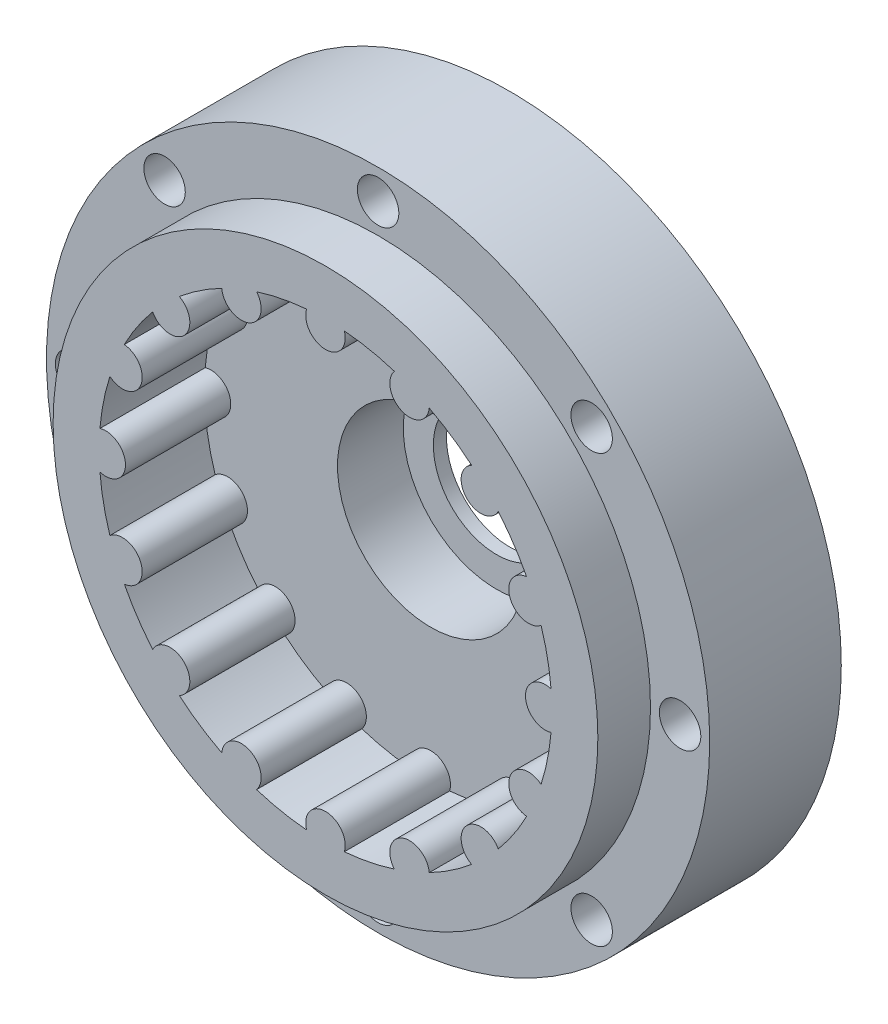
from build123d import *

# Parameters (mm, degrees)
SKETCH1_R           = 32.004
BOSS_EXTRUDE1_DEPTH = 12.7
SKETCH2_OUTSIDE_W   = 84.29
SKETCH2_OUTSIDE_H   = 84.29
SKETCH2_OUTSIDE_R   = 32.004
SKETCH2_OUTSIDE_R_2 = 26.289
CUT_EXTRUDE1_DEPTH  = 2.54
SKETCH4_R           = 13.588999999999995
CUT_EXTRUDE3_DEPTH  = 2.54
SKETCH5_R           = 6.1
CUT_EXTRUDE4_DEPTH  = 46.89745561575282
SKETCH5_3_R         = 9
SKETCH5_3_R_2       = 6.1
CUT_EXTRUDE5_DEPTH  = 6.35
BOSS_EXTRUDE2_START = 7.619999999999999
SKETCH8_R           = 26.289
SKETCH8_R_2         = 21.844
BOSS_EXTRUDE2_DEPTH = 7.619999999999999
SKETCH3_R           = 1.9049999999999996
SKETCH3_R_2         = 1.9050000000000011
SKETCH3_R_3         = 1.9050000000000356
SKETCH3_R_4         = 1.9050000000000542
SKETCH3_R_5         = 1.9050000000000724
SKETCH3_R_6         = 1.9050000000000904
SKETCH3_R_7         = 1.9050000000001055
SKETCH3_R_8         = 1.9050000000001284
SKETCH3_R_9         = 1.9050000000001432
SKETCH3_R_10        = 1.9050000000001643
SKETCH3_R_11        = 1.9050000000001805
SKETCH3_R_12        = 1.9050000000002145
SKETCH3_R_13        = 1.9050000000002163
SKETCH3_R_14        = 1.9050000000002147
SKETCH3_R_15        = 1.9050000000002518
BOSS_EXTRUDE3_DEPTH = 7.619999999999999
SKETCH6_R           = 2.0000000000000004
SKETCH6_R_2         = 2.000000000000001
SKETCH6_R_3         = 1.9999999999999996
SKETCH6_R_4         = 2.0000000000000044
SKETCH6_R_5         = 1.9999999999999971
CUT_EXTRUDE6_DEPTH  = 48.00853148099821
CUT_EXTRUDE7_DEPTH  = 2.54


with BuildPart() as part:
    # Sketch1 → Boss-Extrude1 (new body)
    with BuildSketch(Plane.XY):
        Circle(SKETCH1_R)
    extrude(amount=BOSS_EXTRUDE1_DEPTH)

    # Sketch2 outside → Cut-Extrude1 (cut)
    # profile 1 of 2: a face of its own
    with BuildSketch(Plane.XY.offset(12.7)):
        Rectangle(SKETCH2_OUTSIDE_W, SKETCH2_OUTSIDE_H)
        Circle(SKETCH2_OUTSIDE_R, mode=Mode.SUBTRACT)
    # profile 2 of 2: a face of its own
    with BuildSketch(Plane.XY.offset(12.7)):
        Circle(SKETCH2_OUTSIDE_R_2)
    extrude(amount=-CUT_EXTRUDE1_DEPTH, mode=Mode.SUBTRACT)

    # Sketch4 → Cut-Extrude3 (cut)
    with BuildSketch(Plane.XY.offset(10.159999999999998)):
        Circle(SKETCH4_R)
    extrude(amount=-CUT_EXTRUDE3_DEPTH, mode=Mode.SUBTRACT)

    # Sketch5 → Cut-Extrude4 (cut, through all)
    with BuildSketch(Plane.XY.offset(7.619999999999998)):
        Circle(SKETCH5_R)
    extrude(amount=-CUT_EXTRUDE4_DEPTH, mode=Mode.SUBTRACT)

    # Sketch5<3> → Cut-Extrude5 (cut)
    with BuildSketch(Plane.XY.offset(7.619999999999998)):
        Circle(SKETCH5_3_R)
        Circle(SKETCH5_3_R_2, mode=Mode.SUBTRACT)
    extrude(amount=-CUT_EXTRUDE5_DEPTH, mode=Mode.SUBTRACT)

    # Sketch8 → Boss-Extrude2 (add)
    with BuildSketch(Plane.XY.offset(10.159999999999998).offset(BOSS_EXTRUDE2_START)):
        Circle(SKETCH8_R)
        Circle(SKETCH8_R_2, mode=Mode.SUBTRACT)
    extrude(amount=-BOSS_EXTRUDE2_DEPTH)

    # Sketch3 → Boss-Extrude3 (add)
    with BuildSketch(Plane.XY.offset(10.159999999999998)):
        with Locations((0, 21.209)):
            Circle(SKETCH3_R)
        with Locations((8.116332917031208, 19.59456100503188)):
            Circle(SKETCH3_R_2)
        with Locations((14.997027722185486, 14.997027722185486)):
            Circle(SKETCH3_R_3)
        with Locations((19.594561005031878, 8.116332917031189)):
            Circle(SKETCH3_R_4)
        with Locations((21.209, 1.3e-15)):
            Circle(SKETCH3_R_5)
        with Locations((19.594561005031878, -8.116332917031187)):
            Circle(SKETCH3_R_6)
        with Locations((14.997027722185486, -14.997027722185484)):
            Circle(SKETCH3_R_7)
        with Locations((8.11633291703119, -19.594561005031878)):
            Circle(SKETCH3_R_8)
        with Locations((2.6e-15, -21.209)):
            Circle(SKETCH3_R_9)
        with Locations((-8.116332917031185, -19.59456100503188)):
            Circle(SKETCH3_R_10)
        with Locations((-14.997027722185484, -14.997027722185488)):
            Circle(SKETCH3_R_11)
        with Locations((-19.594561005031874, -8.1163329170312)):
            Circle(SKETCH3_R_12)
        with Locations((-21.209, -3.9e-15)):
            Circle(SKETCH3_R_13)
        with Locations((-19.594561005031878, 8.116332917031194)):
            Circle(SKETCH3_R_14)
        with Locations((-14.997027722185488, 14.99702772218548)):
            Circle(SKETCH3_R_15)
        with Locations((-8.116332917030924, 19.594561005031988)):
            Circle(SKETCH3_R_2)
    extrude(amount=BOSS_EXTRUDE3_DEPTH)

    # Sketch6 → Cut-Extrude6 (cut, through all)
    with BuildSketch(Plane.XY.offset(12.7)):
        with Locations((0, 29.1465)):
            Circle(SKETCH6_R)
        with Locations((20.609687797853738, 20.609687797853674)):
            Circle(SKETCH6_R_2)
        with Locations((29.146500000000003, -1.0176e-13)):
            Circle(SKETCH6_R)
        with Locations((20.609687797853596, -20.609687797853816)):
            Circle(SKETCH6_R_3)
        with Locations((-2.0353e-13, -29.1465)):
            Circle(SKETCH6_R)
        with Locations((-20.609687797853883, -20.60968779785353)):
            Circle(SKETCH6_R_4)
        with Locations((-29.1465, 3.0529e-13)):
            Circle(SKETCH6_R)
        with Locations((-20.609687797853454, 20.609687797853958)):
            Circle(SKETCH6_R_5)
    extrude(amount=-CUT_EXTRUDE6_DEPTH, mode=Mode.SUBTRACT)

    # Sketch9 → Cut-Extrude7 (cut)
    with BuildSketch(Plane.XY.offset(10.159999999999998)):
        with BuildLine():
            ThreePointArc((-1.8211528092368874, 21.767952095808386), (-4.261552994120162, 21.424273665128197), (-6.647708817553131, 20.807890413903724))
            ThreePointArc((-6.647708817553131, 20.807890413903724), (-7.387320978375452, 17.83457049559798), (-10.012760429611932, 19.414040398103573))
            ThreePointArc((-10.012760429611932, 19.414040398103573), (-12.13587617007996, 18.162622211136956), (-14.104517038501491, 16.68001604047853))
            ThreePointArc((-14.104517038501491, 16.68001604047853), (-13.649989304024938, 13.649989304024931), (-16.680016040478538, 14.104517038501484))
            ThreePointArc((-16.680016040478538, 14.104517038501484), (-18.16262221113681, 12.135876170080174), (-19.41404039810333, 10.012760429612404))
            ThreePointArc((-19.41404039810333, 10.012760429612404), (-17.834570495597678, 7.387320978375617), (-20.807890413903703, 6.6477088175531955))
            ThreePointArc((-20.807890413903703, 6.6477088175531955), (-21.424273665128165, 4.261552994120313), (-21.76795209580837, 1.8211528092371132))
            ThreePointArc((-21.76795209580837, 1.8211528092371132), (-19.303999999999785, -1.78e-15), (-21.767952095808365, -1.8211528092371232))
            ThreePointArc((-21.767952095808365, -1.8211528092371232), (-21.424273665128165, -4.261552994120313), (-20.807890413903703, -6.647708817553193))
            ThreePointArc((-20.807890413903703, -6.647708817553193), (-17.834570495597674, -7.387320978375621), (-19.414040398103324, -10.012760429612412))
            ThreePointArc((-19.414040398103324, -10.012760429612412), (-18.16262221113679, -12.135876170080206), (-16.680016040478492, -14.104517038501543))
            ThreePointArc((-16.680016040478492, -14.104517038501543), (-13.649989304024983, -13.64998930402499), (-14.104517038501546, -16.680016040478492))
            ThreePointArc((-14.104517038501546, -16.680016040478492), (-12.135876170080188, -18.162622211136807), (-10.012760429612355, -19.414040398103356))
            ThreePointArc((-10.012760429612355, -19.414040398103356), (-7.387320978375626, -17.834570495597728), (-6.647708817553236, -20.80789041390369))
            ThreePointArc((-6.647708817553236, -20.80789041390369), (-4.2615529941203, -21.42427366512817), (-1.8211528092370566, -21.767952095808372))
            ThreePointArc((-1.8211528092370566, -21.767952095808372), (5.25e-15, -19.303999999999856), (1.821152809237045, -21.767952095808372))
            ThreePointArc((1.821152809237045, -21.767952095808372), (4.261552994120311, -21.424273665128165), (6.647708817553276, -20.807890413903678))
            ThreePointArc((6.647708817553276, -20.807890413903678), (7.387320978375646, -17.83457049559776), (10.012760429612321, -19.414040398103374))
            ThreePointArc((10.012760429612321, -19.414040398103374), (12.135876170080207, -18.162622211136792), (14.10451703850161, -16.680016040478435))
            ThreePointArc((14.10451703850161, -16.680016040478435), (13.649989304025036, -13.649989304025036), (16.68001604047844, -14.104517038501605))
            ThreePointArc((16.68001604047844, -14.104517038501605), (18.162622211136803, -12.135876170080186), (19.414040398103392, -10.012760429612287))
            ThreePointArc((19.414040398103392, -10.012760429612287), (17.834570495597795, -7.387320978375656), (20.807890413903664, -6.647708817553317))
            ThreePointArc((20.807890413903664, -6.647708817553317), (21.42427366512817, -4.2615529941202945), (21.76795209580838, -1.8211528092369615))
            ThreePointArc((21.76795209580838, -1.8211528092369615), (19.303999999999927, 1.53e-15), (21.76795209580838, 1.8211528092369678))
            ThreePointArc((21.76795209580838, 1.8211528092369678), (21.424273665128165, 4.261552994120317), (20.807890413903653, 6.6477088175533545))
            ThreePointArc((20.807890413903653, 6.6477088175533545), (17.834570495597823, 7.387320978375673), (19.414040398103413, 10.01276042961225))
            ThreePointArc((19.414040398103413, 10.01276042961225), (18.162622211136796, 12.135876170080202), (16.680016040478385, 14.104517038501665))
            ThreePointArc((16.680016040478385, 14.104517038501665), (13.64998930402509, 13.64998930402509), (14.104517038501664, 16.680016040478385))
            ThreePointArc((14.104517038501664, 16.680016040478385), (12.135876170080184, 18.1626222111368), (10.012760429612218, 19.414040398103428))
            ThreePointArc((10.012760429612218, 19.414040398103428), (7.387320978375711, 17.83457049559788), (6.647708817553421, 20.80789041390363))
            ThreePointArc((6.647708817553421, 20.80789041390363), (4.261552994120311, 21.424273665128165), (1.8211528092368898, 21.767952095808386))
            ThreePointArc((1.8211528092368898, 21.767952095808386), (-3.5e-16, 19.304000000000002), (-1.8211528092368874, 21.767952095808386))
        make_face()
    extrude(amount=-CUT_EXTRUDE7_DEPTH, mode=Mode.SUBTRACT)


solid = part.part
